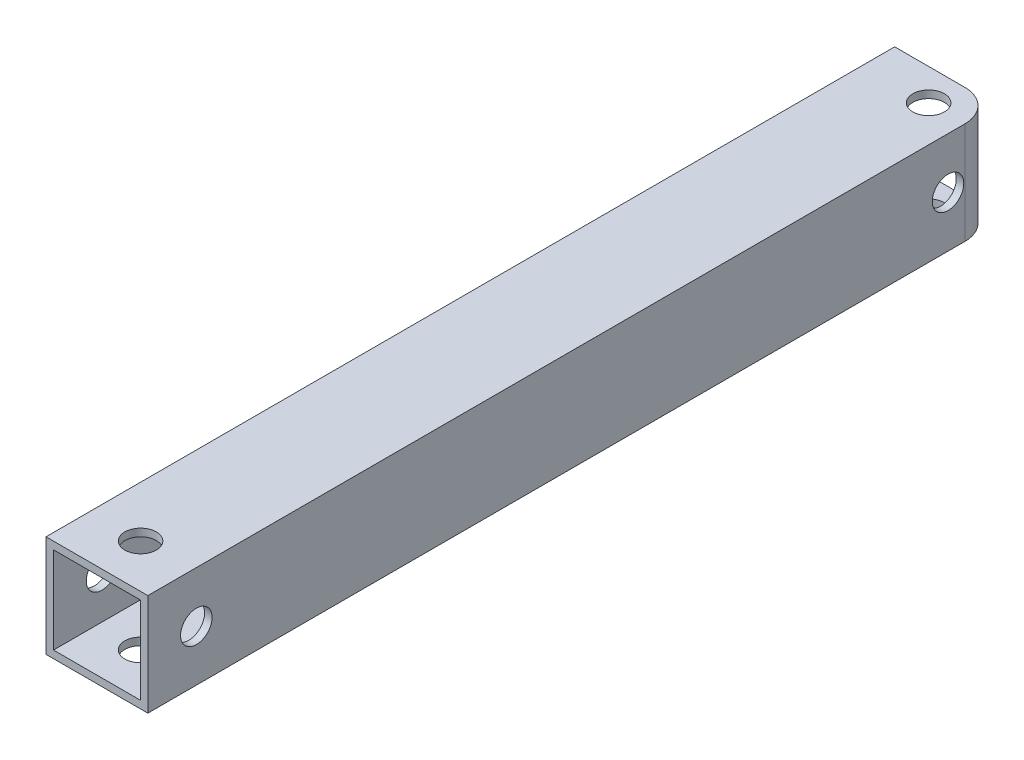
from build123d import *

# Parameters (mm, degrees)
CROQUIS1_W              = 42
CROQUIS1_H              = 42
SALIENTE_EXTRUIR1_DEPTH = 175
CORTAR_EXTRUIR1_DEPTH   = 355.297078735
CROQUIS3_R              = 6.5
CORTAR_EXTRUIR3_DEPTH   = 60
CROQUIS4_R              = 6.5
CORTAR_EXTRUIR4_DEPTH   = 70
CROQUIS5_R              = 6.5
CORTAR_EXTRUIR5_DEPTH   = 182.190507478
REDONDEO1_R             = 13
CROQUIS6_R              = 6.5
CORTAR_EXTRUIR6_DEPTH   = 60


with BuildPart() as part:
    # Croquis1 → Saliente-Extruir1 (new, symmetric)
    with BuildSketch(Plane.XY):
        Rectangle(CROQUIS1_W, CROQUIS1_H)
    extrude(amount=SALIENTE_EXTRUIR1_DEPTH, both=True)

    # Croquis3D1 → Cortar-Extruir1 (cut, through all)
    with BuildSketch(Plane(origin=(-17.9, -17.9, 175), x_dir=(0.7071067811865475, 0.7071067811865477, 0), z_dir=(0, 0, 1))):
        Polygon((0, 0), (25.314422766, -25.314422766), (50.628845533, 0), (25.314422766, 25.314422766), align=None)
    extrude(amount=-CORTAR_EXTRUIR1_DEPTH, mode=Mode.SUBTRACT)

    # Croquis3 → Cortar-Extruir3 (cut)
    with BuildSketch(Plane.XZ.offset(21)):
        with Locations((0, 157)):
            Circle(CROQUIS3_R)
    extrude(amount=-CORTAR_EXTRUIR3_DEPTH, mode=Mode.SUBTRACT)

    # Croquis4 → Cortar-Extruir4 (cut)
    with BuildSketch(Plane(origin=(21, 0, 0), x_dir=(0, 0, -1), z_dir=(1, 0, 0))):
        with Locations(Location((155, 0, 0), (0, 0, 90))):
            Circle(CROQUIS4_R)
    extrude(amount=-CORTAR_EXTRUIR4_DEPTH, mode=Mode.SUBTRACT)

    # Croquis5 → Cortar-Extruir5 (cut, through all)
    with BuildSketch(Plane(origin=(0, 21, 0), x_dir=(1, 0, 0), z_dir=(0, 1, 0))):
        with Locations(Location((6, 162, 0), (0, 0, 180))):
            Circle(CROQUIS5_R)
    extrude(amount=-CORTAR_EXTRUIR5_DEPTH, mode=Mode.SUBTRACT)

    # Redondeo1
    # the kernel refuses this fillet: 13 mm, written as the material it takes off along each edge
    with BuildSketch(Plane(origin=(21, 53.5, -175), x_dir=(0, 0, 1), z_dir=(0, -1, 0))) as redondeo1_piece_1:
        with BuildLine():
            CenterArc((REDONDEO1_R, REDONDEO1_R), REDONDEO1_R, 180, 90)
            Line((0, REDONDEO1_R), (0, 0))
            Line((0, 0), (REDONDEO1_R, 0))
        make_face()
    extrude(amount=107, mode=Mode.SUBTRACT)

    # Croquis6 → Cortar-Extruir6 (cut)
    with BuildSketch(Plane.ZY.offset(21)):
        with Locations(Location((155, 0, 0), (0, 0, 270))):
            Circle(CROQUIS6_R)
    extrude(amount=-CORTAR_EXTRUIR6_DEPTH, mode=Mode.SUBTRACT)


solid = part.part
